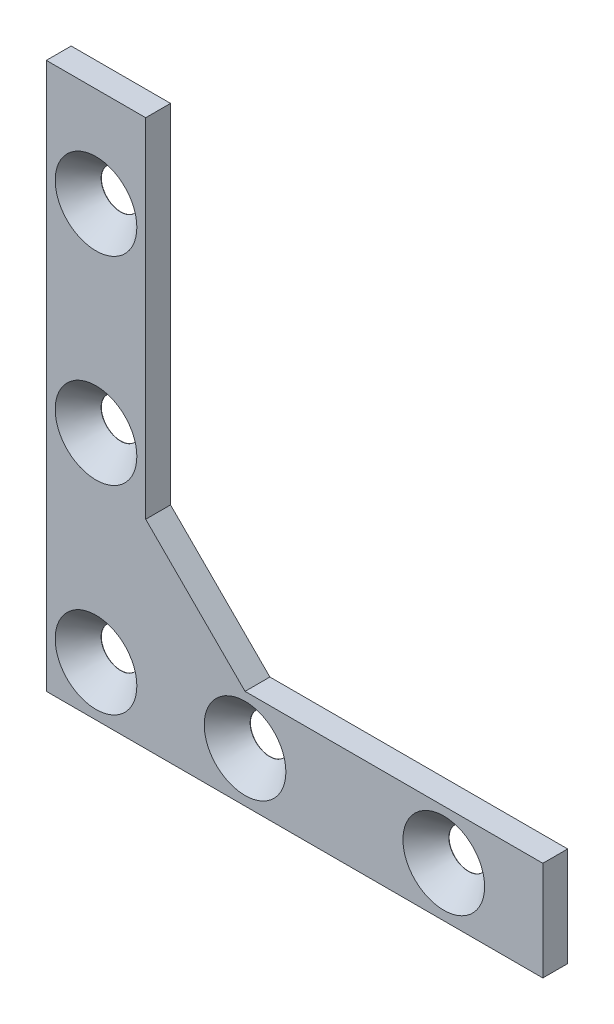
from build123d import *

# Parameters (mm, degrees)
BOSS_EXTRUDE1_DEPTH             = 3.175
F_10_CLEARANCE_HOLE1_AT_2_COUNT = 2
F_10_CLEARANCE_HOLE1_AT_2_PITCH = 25.4
F_10_CLEARANCE_HOLE1_AT_3_COUNT = 2
F_10_CLEARANCE_HOLE1_AT_3_PITCH = 50.761770585
F_10_CLEARANCE_HOLE1_AT_4_COUNT = 2
F_10_CLEARANCE_HOLE1_AT_4_PITCH = 19.05
F_10_CLEARANCE_HOLE1_AT_5_COUNT = 2
F_10_CLEARANCE_HOLE1_AT_5_PITCH = 44.45


with BuildPart() as part:
    # Sketch1 → Boss-Extrude1 (new body)
    with BuildSketch(Plane.XY):
        Polygon((-273.453367516, -6.35), (-273.453367516, 63.5), (-260.753367516, 63.5), (-260.753367516, 19.05), (-248.053367516, 6.35), (-209.991596931, 6.35), (-209.991596931, -6.35), align=None)
    extrude(amount=BOSS_EXTRUDE1_DEPTH)

    # Sketch4 → #10 Clearance Hole1 (revolve, cut)
    with BuildSketch(Plane(origin=(-267.103367516, 0.038229415, 3.175), x_dir=(0, -1, 0), z_dir=(1, 0, 0))):
        Polygon((0, 0), (0, 3.175), (2.4892, 3.175), (2.4892, 3.141080936), (5.2197, 0), align=None)
    f_10_clearance_hole1 = revolve(axis=Axis((-267.103367516, 0.038229415, 9.525), (0, 0, -1)), mode=Mode.SUBTRACT)

    # #10 Clearance Hole1 at 2: #10 Clearance Hole1 ×2
    with Locations(*[(0, i * F_10_CLEARANCE_HOLE1_AT_2_PITCH, 0) for i in range(1, F_10_CLEARANCE_HOLE1_AT_2_COUNT)]):
        add(f_10_clearance_hole1, mode=Mode.SUBTRACT)

    # #10 Clearance Hole1 at 3: #10 Clearance Hole1 ×2
    with Locations(*[(0, i * F_10_CLEARANCE_HOLE1_AT_3_PITCH, 0) for i in range(1, F_10_CLEARANCE_HOLE1_AT_3_COUNT)]):
        add(f_10_clearance_hole1, mode=Mode.SUBTRACT)

    # #10 Clearance Hole1 at 4: #10 Clearance Hole1 ×2
    with Locations(*[(i * F_10_CLEARANCE_HOLE1_AT_4_PITCH, 0, 0) for i in range(1, F_10_CLEARANCE_HOLE1_AT_4_COUNT)]):
        add(f_10_clearance_hole1, mode=Mode.SUBTRACT)

    # #10 Clearance Hole1 at 5: #10 Clearance Hole1 ×2
    with Locations(*[(i * F_10_CLEARANCE_HOLE1_AT_5_PITCH, 0, 0) for i in range(1, F_10_CLEARANCE_HOLE1_AT_5_COUNT)]):
        add(f_10_clearance_hole1, mode=Mode.SUBTRACT)


solid = part.part
